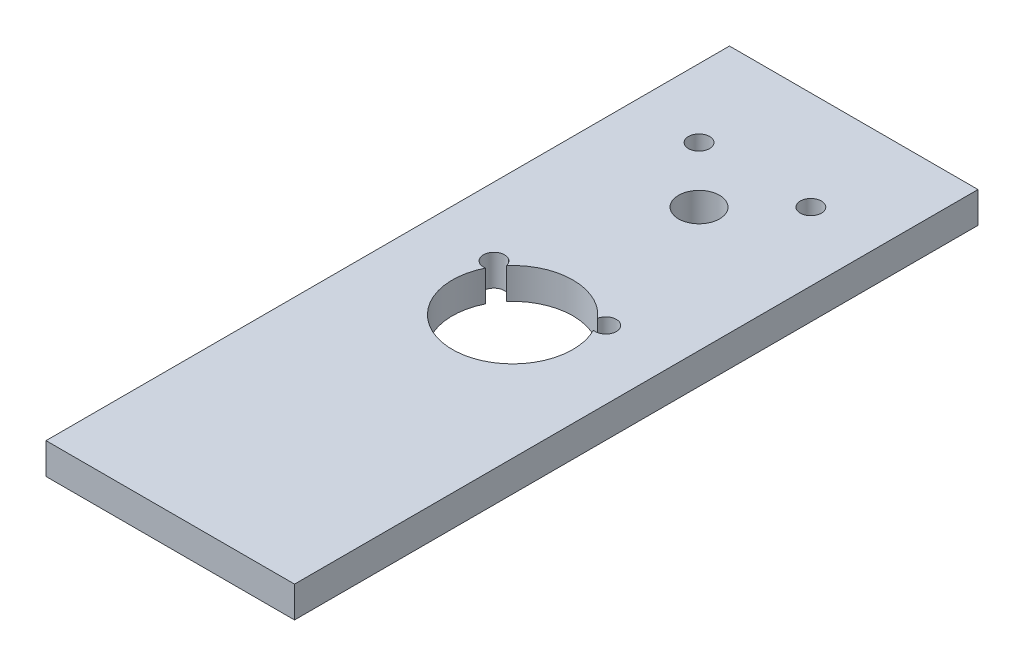
from build123d import *

# Parameters (mm, degrees)
SKETCH2_W           = 40
SKETCH2_H           = 110
BOSS_EXTRUDE1_DEPTH = 5
SKETCH3_R           = 3.3
SKETCH3_R_2         = 9.7
CUT_EXTRUDE1_DEPTH  = 118.153745139
SKETCH5_R           = 1.7
CUT_EXTRUDE2_DEPTH  = 118.153745139


with BuildPart() as part:
    # Sketch2 → Boss-Extrude1 (new body)
    with BuildSketch(Plane(origin=(0, 0, 0), x_dir=(1, 0, 0), z_dir=(0, 1, 0))):
        with Locations((20, 55)):
            Rectangle(SKETCH2_W, SKETCH2_H)
    extrude(amount=BOSS_EXTRUDE1_DEPTH)

    # Sketch3 → Cut-Extrude1 (cut, through all)
    with BuildSketch(Plane(origin=(0, 5, 0), x_dir=(1, 0, 0), z_dir=(0, 1, 0))):
        with Locations((20, 85.1)):
            Circle(SKETCH3_R)
        with Locations((20, 55.1)):
            Circle(SKETCH3_R_2)
    extrude(amount=-CUT_EXTRUDE1_DEPTH, mode=Mode.SUBTRACT)

    # Sketch5 → Cut-Extrude2 (cut, through all)
    with BuildSketch(Plane(origin=(0, 5, 0), x_dir=(1, 0, 0), z_dir=(0, 1, 0))):
        with Locations((11, 94.1)):
            Circle(SKETCH5_R)
        with Locations((11, 61.1)):
            Circle(SKETCH5_R)
    cut_extrude2 = extrude(amount=-CUT_EXTRUDE2_DEPTH, mode=Mode.SUBTRACT)

    # Mirror1: Cut-Extrude2 across plane
    add(cut_extrude2.mirror(Plane(origin=(20, 0, 0), x_dir=(0, 0, 1), z_dir=(1, 0, 0))), mode=Mode.SUBTRACT)


solid = part.part
